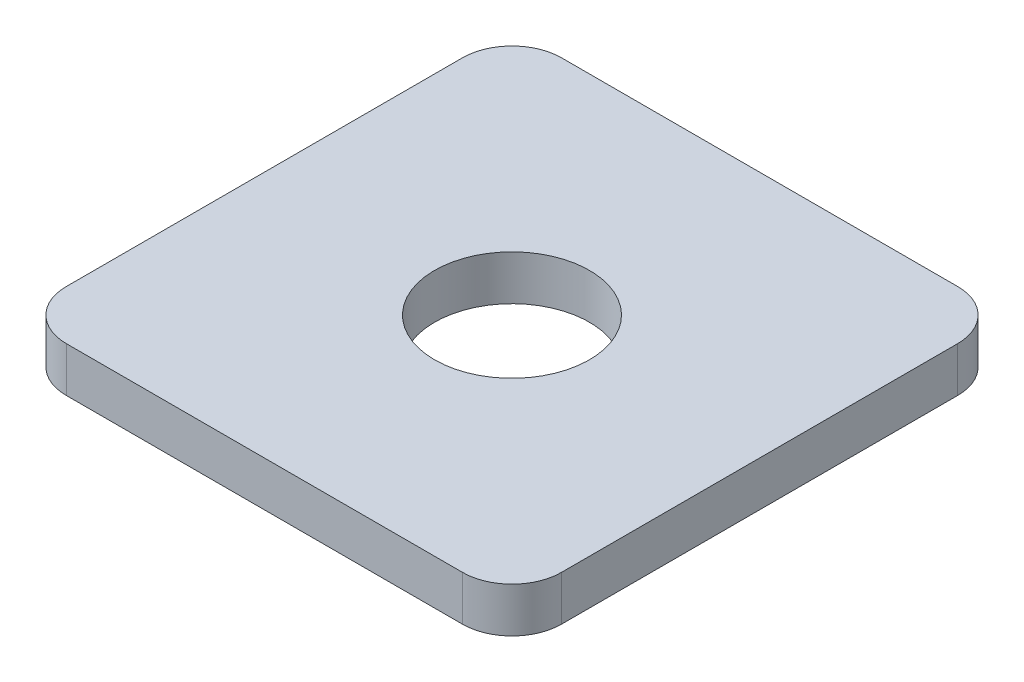
from build123d import *

# Parameters (mm, degrees)
BOSS_EXTRUDE1_DEPTH = 6.35
SKETCH2_R           = 10.95
CUT_EXTRUDE1_DEPTH  = 6.35


with BuildPart() as part:
    # Sketch1 → Boss-Extrude1 (new body)
    with BuildSketch(Plane(origin=(0, 0, 0), x_dir=(1, 0, 0), z_dir=(0, 1, 0))):
        with BuildLine():
            Line((7, 0), (63, 0))
            ThreePointArc((63, 0), (67.949747468, 2.050252532), (70, 7))
            Line((70, 7), (70, 63))
            ThreePointArc((70, 63), (67.949747468, 67.949747468), (63, 70))
            Line((63, 70), (7, 70))
            ThreePointArc((7, 70), (2.050252532, 67.949747468), (0, 63))
            Line((0, 63), (0, 7))
            ThreePointArc((0, 7), (2.050252532, 2.050252532), (7, 0))
        make_face()
    extrude(amount=BOSS_EXTRUDE1_DEPTH)

    # Sketch2 → Cut-Extrude1 (cut)
    with BuildSketch(Plane(origin=(0, 6.35, 0), x_dir=(1, 0, 0), z_dir=(0, 1, 0))):
        with Locations((35, 35)):
            Circle(SKETCH2_R)
    extrude(amount=-CUT_EXTRUDE1_DEPTH, mode=Mode.SUBTRACT)


solid = part.part
